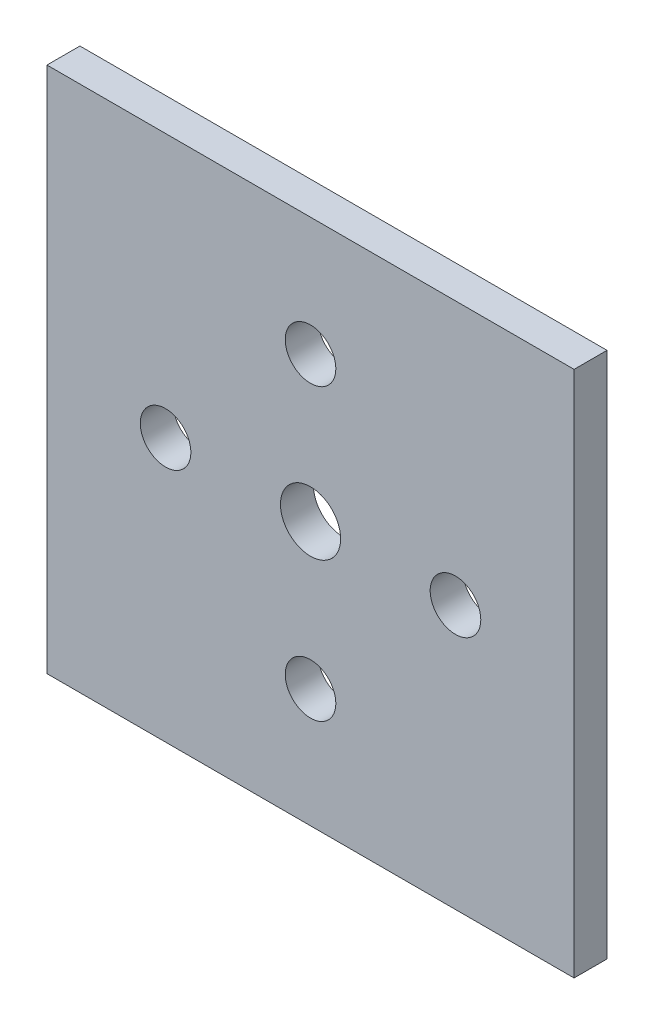
from build123d import *

# Parameters (mm, degrees)
SKETCH1_W              = 25.4
SKETCH1_H              = 25.4
BASE_FLANGE1_DEPTH     = 1.5875
M2_5_CLEARANCE_HOLE1_D = 2.9
F_2_CLEARANCE_HOLE1_D  = 2.4384
CIRPATTERN1_COUNT      = 4


# Sheet-metal steps are written as plain solids
with BuildPart() as part:
    # Sketch1 → Base-Flange1 (new body)
    with BuildSketch(Plane.XY):
        with Locations((12.7, 12.7)):
            Rectangle(SKETCH1_W, SKETCH1_H)
    extrude(amount=-BASE_FLANGE1_DEPTH)

    # M2.5 Clearance Hole1 (through all)
    with Locations(Plane.XY):
        with Locations((12.7, 12.7)):
            Hole(M2_5_CLEARANCE_HOLE1_D / 2)

    # #2 Clearance Hole1 (through all)
    with Locations(Plane.XY):
        with Locations((19.685, 12.7)):
            f_2_clearance_hole1 = Hole(F_2_CLEARANCE_HOLE1_D / 2)

    # CirPattern1: #2 Clearance Hole1 ×4 about axis
    cirpattern1_axis = Axis((12.7, 12.7, 0), (0, 0, 1))
    for i in range(1, CIRPATTERN1_COUNT):
        add(f_2_clearance_hole1.rotate(cirpattern1_axis, i * 360 / CIRPATTERN1_COUNT), mode=Mode.SUBTRACT)


solid = part.part
